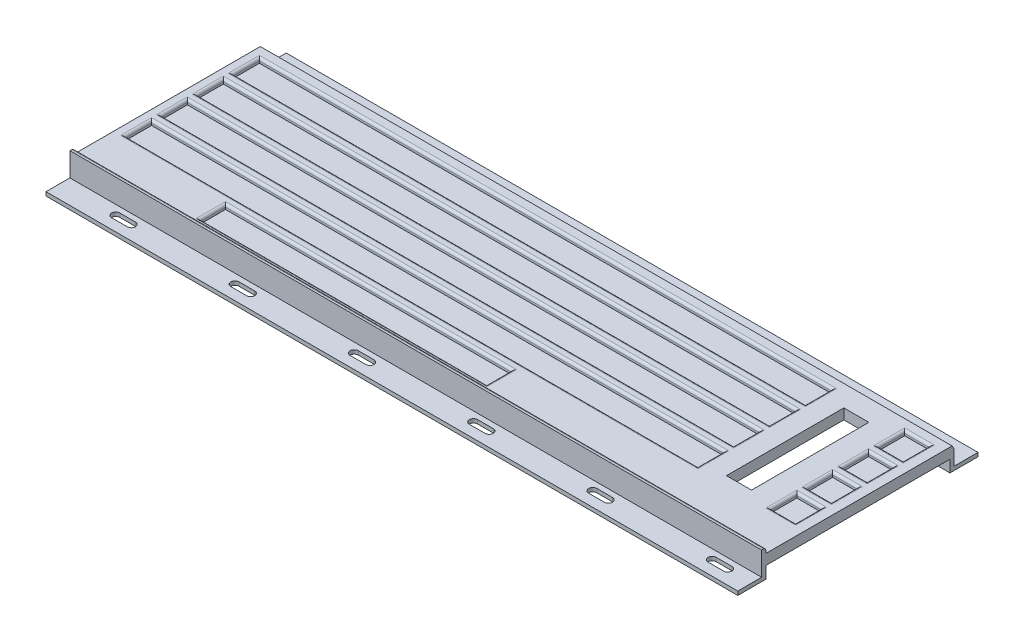
from build123d import *

# Parameters (mm, degrees)
SKETCH1_W                            = 368.3
SKETCH1_H                            = 98.044
BOSS_EXTRUDE1_DEPTH                  = 3.175
SKETCH2_W                            = 368.3
SKETCH2_H                            = 4.445
BOSS_EXTRUDE2_DEPTH                  = 2.38125
SKETCH3_W                            = 368.3
SKETCH3_H                            = 3.81
BOSS_EXTRUDE3_DEPTH                  = 2.38125
SKETCH4_W                            = 368.3
SKETCH4_H                            = 5.08
BOSS_EXTRUDE4_DEPTH                  = 2.38125
SKETCH5_W                            = 368.3
SKETCH5_H                            = 5.08
BOSS_EXTRUDE5_DEPTH                  = 2.38125
SKETCH7_W                            = 368.3
SKETCH7_H                            = 5.08
BOSS_EXTRUDE6_DEPTH                  = 2.38125
SKETCH9_W                            = 368.3
SKETCH9_H                            = 5.08
BOSS_EXTRUDE7_DEPTH                  = 2.38125
SKETCH10_W                           = 6.35
SKETCH10_H                           = 89.789
BOSS_EXTRUDE8_DEPTH                  = 2.38125
SKETCH11_W                           = 5.08
SKETCH11_H                           = 89.789
BOSS_EXTRUDE9_DEPTH                  = 2.38125
SKETCH12_W                           = 13.97
SKETCH12_H                           = 89.789
BOSS_EXTRUDE10_DEPTH                 = 2.38125
SKETCH13_W                           = 12.7
SKETCH13_H                           = 89.789
BOSS_EXTRUDE11_DEPTH                 = 2.38125
SKETCH14_W                           = 13.335
SKETCH14_H                           = 62.484
CUT_EXTRUDE1_DEPTH                   = 191.644304657
SKETCH15_W                           = 12.065
SKETCH15_H                           = 13.335
BOSS_EXTRUDE12_DEPTH                 = 2.38125
SKETCH16_W                           = 12.065
SKETCH16_H                           = 3.175
BOSS_EXTRUDE13_DEPTH                 = 2.38125
SKETCH17_W                           = 12.065
SKETCH17_H                           = 5.715
BOSS_EXTRUDE14_DEPTH                 = 2.38125
SKETCH18_W                           = 13.335
SKETCH18_H                           = 13.335
BOSS_EXTRUDE15_DEPTH                 = 2.38125
SKETCH19_W                           = 58.42
SKETCH19_H                           = 13.335
BOSS_EXTRUDE16_DEPTH                 = 2.38125
SKETCH20_W                           = 93.98
SKETCH20_H                           = 13.335
BOSS_EXTRUDE17_DEPTH                 = 2.38125
SKETCH22_W                           = 368.3
SKETCH22_H                           = 14.605
BOSS_EXTRUDE18_DEPTH                 = 2.2225
SKETCH23_W                           = 368.3
SKETCH23_H                           = 2.032
BOSS_EXTRUDE19_DEPTH                 = 12.7
SKETCH24_W                           = 368.3
SKETCH24_H                           = 11.90625
BOSS_EXTRUDE20_DEPTH                 = 2.2225
SKETCH25_W                           = 368.3
SKETCH25_H                           = 2.032
BOSS_EXTRUDE21_DEPTH                 = 12.7
F_11_64_START                        = -6.35
F_11_64_0_17188_DIAMETER_SLOT1_DEPTH = 2.032
FILLET2_R                            = 1.27
CHAMFER1_SIZE                        = 1.905
CHAMFER1_SIZE2                       = 1.099852263


# Read off the part's stored shape, not the designer's step: 11/64 (0.17188) Diameter Slot1
with BuildPart() as part:
    # Sketch1 → Boss-Extrude1 (new body)
    with BuildSketch(Plane(origin=(0, 0, 0), x_dir=(1, 0, 0), z_dir=(0, 1, 0))):
        Rectangle(SKETCH1_W, SKETCH1_H)
    extrude(amount=BOSS_EXTRUDE1_DEPTH)

    # Sketch2 → Boss-Extrude2 (add)
    with BuildSketch(Plane(origin=(0, 3.175, 0), x_dir=(1, 0, 0), z_dir=(0, 1, 0))):
        with Locations((0, 46.7995)):
            Rectangle(SKETCH2_W, SKETCH2_H)
    extrude(amount=BOSS_EXTRUDE2_DEPTH)

    # Sketch3 → Boss-Extrude3 (add)
    with BuildSketch(Plane(origin=(0, 3.175, 0), x_dir=(1, 0, 0), z_dir=(0, 1, 0))):
        with Locations((0, -47.117)):
            Rectangle(SKETCH3_W, SKETCH3_H)
    extrude(amount=BOSS_EXTRUDE3_DEPTH)

    # Sketch4 → Boss-Extrude4 (add)
    with BuildSketch(Plane(origin=(0, 3.175, 0), x_dir=(1, 0, 0), z_dir=(0, 1, 0))):
        with Locations((0, -29.337)):
            Rectangle(SKETCH4_W, SKETCH4_H)
    extrude(amount=BOSS_EXTRUDE4_DEPTH)

    # Sketch5 → Boss-Extrude5 (add)
    with BuildSketch(Plane(origin=(0, 3.175, 0), x_dir=(1, 0, 0), z_dir=(0, 1, 0))):
        with Locations((0, -10.287)):
            Rectangle(SKETCH5_W, SKETCH5_H)
    extrude(amount=BOSS_EXTRUDE5_DEPTH)

    # Sketch7 → Boss-Extrude6 (add)
    with BuildSketch(Plane(origin=(0, 3.175, 0), x_dir=(1, 0, 0), z_dir=(0, 1, 0))):
        with Locations((0, 8.763)):
            Rectangle(SKETCH7_W, SKETCH7_H)
    extrude(amount=BOSS_EXTRUDE6_DEPTH)

    # Sketch9 → Boss-Extrude7 (add)
    with BuildSketch(Plane(origin=(0, 3.175, 0), x_dir=(1, 0, 0), z_dir=(0, 1, 0))):
        with Locations((0, 27.94)):
            Rectangle(SKETCH9_W, SKETCH9_H)
    extrude(amount=BOSS_EXTRUDE7_DEPTH)

    # Sketch10 → Boss-Extrude8 (add)
    with BuildSketch(Plane(origin=(0, 3.175, 0), x_dir=(1, 0, 0), z_dir=(0, 1, 0))):
        with Locations((180.975, -0.3175)):
            Rectangle(SKETCH10_W, SKETCH10_H)
    extrude(amount=BOSS_EXTRUDE8_DEPTH)

    # Sketch11 → Boss-Extrude9 (add)
    with BuildSketch(Plane(origin=(0, 3.175, 0), x_dir=(1, 0, 0), z_dir=(0, 1, 0))):
        with Locations((-181.61, -0.3175)):
            Rectangle(SKETCH11_W, SKETCH11_H)
    extrude(amount=BOSS_EXTRUDE9_DEPTH)

    # Sketch12 → Boss-Extrude10 (add)
    with BuildSketch(Plane(origin=(0, 3.175, 0), x_dir=(1, 0, 0), z_dir=(0, 1, 0))):
        with Locations((157.48, -0.3175)):
            Rectangle(SKETCH12_W, SKETCH12_H)
    extrude(amount=BOSS_EXTRUDE10_DEPTH)

    # Sketch13 → Boss-Extrude11 (add)
    with BuildSketch(Plane(origin=(0, 3.175, 0), x_dir=(1, 0, 0), z_dir=(0, 1, 0))):
        with Locations((132.08, -0.3175)):
            Rectangle(SKETCH13_W, SKETCH13_H)
    extrude(amount=BOSS_EXTRUDE11_DEPTH)

    # Sketch14 → Cut-Extrude1 (cut, through all)
    with BuildSketch(Plane(origin=(0, 5.55625, 0), x_dir=(1, 0, 0), z_dir=(0, 1, 0))):
        with Locations((144.4625, 7.62)):
            Rectangle(SKETCH14_W, SKETCH14_H)
    extrude(amount=-CUT_EXTRUDE1_DEPTH, mode=Mode.SUBTRACT)

    # Sketch15 → Boss-Extrude12 (add)
    with BuildSketch(Plane(origin=(0, 3.175, 0), x_dir=(1, 0, 0), z_dir=(0, 1, 0))):
        with Locations((144.4625, -38.5445)):
            Rectangle(SKETCH15_W, SKETCH15_H)
    extrude(amount=BOSS_EXTRUDE12_DEPTH)

    # Sketch16 → Boss-Extrude13 (add)
    with BuildSketch(Plane(origin=(0, 3.175, 0), x_dir=(1, 0, 0), z_dir=(0, 1, 0))):
        with Locations((144.4625, -25.2095)):
            Rectangle(SKETCH16_W, SKETCH16_H)
    extrude(amount=BOSS_EXTRUDE13_DEPTH)

    # Sketch17 → Boss-Extrude14 (add)
    with BuildSketch(Plane(origin=(0, 3.175, 0), x_dir=(1, 0, 0), z_dir=(0, 1, 0))):
        with Locations((144.4625, 41.7195)):
            Rectangle(SKETCH17_W, SKETCH17_H)
    extrude(amount=BOSS_EXTRUDE14_DEPTH)

    # Sketch18 → Boss-Extrude15 (add)
    with BuildSketch(Plane(origin=(0, 3.175, 0), x_dir=(1, 0, 0), z_dir=(0, 1, 0))):
        with Locations((171.1325, -38.5445)):
            Rectangle(SKETCH18_W, SKETCH18_H)
    extrude(amount=BOSS_EXTRUDE15_DEPTH)

    # Sketch19 → Boss-Extrude16 (add)
    with BuildSketch(Plane(origin=(0, 3.175, 0), x_dir=(1, 0, 0), z_dir=(0, 1, 0))):
        with Locations((-149.86, -38.5445)):
            Rectangle(SKETCH19_W, SKETCH19_H)
    extrude(amount=BOSS_EXTRUDE16_DEPTH)

    # Sketch20 → Boss-Extrude17 (add)
    with BuildSketch(Plane(origin=(0, 3.175, 0), x_dir=(1, 0, 0), z_dir=(0, 1, 0))):
        with Locations((78.74, -38.5445)):
            Rectangle(SKETCH20_W, SKETCH20_H)
    extrude(amount=BOSS_EXTRUDE17_DEPTH)

    # Sketch22 → Boss-Extrude18 (add)
    with BuildSketch(Plane.XY.offset(49.022)):
        with Locations((0, 0.9525)):
            Rectangle(SKETCH22_W, SKETCH22_H)
    extrude(amount=BOSS_EXTRUDE18_DEPTH)

    # Sketch23 → Boss-Extrude19 (add)
    with BuildSketch(Plane.XY.offset(51.2445)):
        with Locations((0, -5.334)):
            Rectangle(SKETCH23_W, SKETCH23_H)
    extrude(amount=BOSS_EXTRUDE19_DEPTH)

    # Sketch24 → Boss-Extrude20 (add)
    with BuildSketch(Plane(origin=(0, 0, -49.022), x_dir=(-1, 0, 0), z_dir=(0, 0, -1))):
        with Locations((0, -0.396875)):
            Rectangle(SKETCH24_W, SKETCH24_H)
    extrude(amount=BOSS_EXTRUDE20_DEPTH)

    # Sketch25 → Boss-Extrude21 (add)
    with BuildSketch(Plane(origin=(0, 0, -51.2445), x_dir=(-1, 0, 0), z_dir=(0, 0, -1))):
        with Locations((0, -5.334)):
            Rectangle(SKETCH25_W, SKETCH25_H)
    extrude(amount=BOSS_EXTRUDE21_DEPTH)

    # 11/64 (0.17188) Diameter Slot1 outline → 11/64 (0.17188) Diameter Slot1 (cut)
    with BuildSketch(Plane(origin=(0, 0, 0), x_dir=(1, 0, 0), z_dir=(0, 1, 0)).offset(F_11_64_START)):
        with BuildLine():
            Line((-154.662124, -58.507376), (-146.327876, -58.507376))
            ThreePointArc((-146.327876, -58.507376), (-144.145, -56.3245), (-146.327876, -54.141624))
            Line((-146.327876, -54.141624), (-154.662124, -54.141624))
            ThreePointArc((-154.662124, -54.141624), (-156.845, -56.3245), (-154.662124, -58.507376))
        make_face()
        with BuildLine():
            ThreePointArc((-82.827876, -58.507376), (-80.645, -56.3245), (-82.827876, -54.141624))
            Line((-82.827876, -54.141624), (-91.162124, -54.141624))
            ThreePointArc((-91.162124, -54.141624), (-93.345, -56.3245), (-91.162124, -58.507376))
            Line((-91.162124, -58.507376), (-82.827876, -58.507376))
        make_face()
        with BuildLine():
            ThreePointArc((-19.327876, -58.507376), (-17.145, -56.3245), (-19.327876, -54.141624))
            Line((-19.327876, -54.141624), (-27.662124, -54.141624))
            ThreePointArc((-27.662124, -54.141624), (-29.845, -56.3245), (-27.662124, -58.507376))
            Line((-27.662124, -58.507376), (-19.327876, -58.507376))
        make_face()
        with BuildLine():
            ThreePointArc((44.172124, -58.50737603), (46.355, -56.32450003), (44.172124, -54.14162403))
            Line((44.172124, -54.14162403), (35.837876, -54.14162403))
            ThreePointArc((35.837876, -54.14162403), (33.655, -56.32450003), (35.837876, -58.50737603))
            Line((35.837876, -58.50737603), (44.172124, -58.50737603))
        make_face()
        with BuildLine():
            ThreePointArc((107.672124, -58.50737603), (109.855, -56.32450003), (107.672124, -54.14162403))
            Line((107.672124, -54.14162403), (99.337876, -54.14162403))
            ThreePointArc((99.337876, -54.14162403), (97.155, -56.32450003), (99.337876, -58.50737603))
            Line((99.337876, -58.50737603), (107.672124, -58.50737603))
        make_face()
        with BuildLine():
            ThreePointArc((171.172124, -58.507376), (173.355, -56.3245), (171.172124, -54.141624))
            Line((171.172124, -54.141624), (162.837876, -54.141624))
            ThreePointArc((162.837876, -54.141624), (160.655, -56.3245), (162.837876, -58.507376))
            Line((162.837876, -58.507376), (171.172124, -58.507376))
        make_face()
        with BuildLine():
            Line((-154.662124, 55.411624), (-146.327876, 55.411624))
            ThreePointArc((-146.327876, 55.411624), (-144.145, 57.5945), (-146.327876, 59.777376))
            Line((-146.327876, 59.777376), (-154.662124, 59.777376))
            ThreePointArc((-154.662124, 59.777376), (-156.845, 57.5945), (-154.662124, 55.411624))
        make_face()
        with BuildLine():
            ThreePointArc((-82.827876, 55.411624), (-80.645, 57.5945), (-82.827876, 59.777376))
            Line((-82.827876, 59.777376), (-91.162124, 59.777376))
            ThreePointArc((-91.162124, 59.777376), (-93.345, 57.5945), (-91.162124, 55.411624))
            Line((-91.162124, 55.411624), (-82.827876, 55.411624))
        make_face()
        with BuildLine():
            ThreePointArc((-38.377876, 55.411624), (-36.195, 57.5945), (-38.377876, 59.777376))
            Line((-38.377876, 59.777376), (-46.712124, 59.777376))
            ThreePointArc((-46.712124, 59.777376), (-48.895, 57.5945), (-46.712124, 55.411624))
            Line((-46.712124, 55.411624), (-38.377876, 55.411624))
        make_face()
        with BuildLine():
            ThreePointArc((63.222124, 55.411624), (65.405, 57.5945), (63.222124, 59.777376))
            Line((63.222124, 59.777376), (54.887876, 59.777376))
            ThreePointArc((54.887876, 59.777376), (52.705, 57.5945), (54.887876, 55.411624))
            Line((54.887876, 55.411624), (63.222124, 55.411624))
        make_face()
        with BuildLine():
            ThreePointArc((107.672124, 55.411624), (109.855, 57.5945), (107.672124, 59.777376))
            Line((107.672124, 59.777376), (99.337876, 59.777376))
            ThreePointArc((99.337876, 59.777376), (97.155, 57.5945), (99.337876, 55.411624))
            Line((99.337876, 55.411624), (107.672124, 55.411624))
        make_face()
        with BuildLine():
            ThreePointArc((171.172124, 55.411624), (173.355, 57.5945), (171.172124, 59.777376))
            Line((171.172124, 59.777376), (162.837876, 59.777376))
            ThreePointArc((162.837876, 59.777376), (160.655, 57.5945), (162.837876, 55.411624))
            Line((162.837876, 55.411624), (171.172124, 55.411624))
        make_face()
    extrude(amount=F_11_64_0_17188_DIAMETER_SLOT1_DEPTH, mode=Mode.SUBTRACT)

    # Fillet2
    fillet2_edges = [part.edges().sort_by_distance(p)[0] for p in [
        (177.8, 5.55625, 19.812),
        (177.8, 5.55625, 0.762),
        (177.8, 5.55625, -18.3515),
        (177.8, 5.55625, -37.5285),
        (-26.67, 5.55625, -44.577),
        (-26.67, 5.55625, -25.4),
        (-26.67, 5.55625, -6.223),
        (-26.67, 5.55625, 12.827),
        (-179.07, 5.55625, 19.812),
        (-179.07, 5.55625, 0.762),
        (-179.07, 5.55625, -18.3515),
        (-179.07, 5.55625, -37.5285),
        (171.1325, 5.55625, 12.827),
        (171.1325, 5.55625, -6.223),
        (171.1325, 5.55625, -25.4),
        (171.1325, 5.55625, -44.577),
        (164.465, 5.55625, 19.812),
        (164.465, 5.55625, 0.762),
        (164.465, 5.55625, -18.3515),
        (164.465, 5.55625, -37.5285),
        (-26.67, 5.55625, 26.797),
        (-26.67, 5.55625, 7.747),
        (-26.67, 5.55625, -11.303),
        (-26.67, 5.55625, -30.48),
        (125.73, 5.55625, 19.812),
        (125.73, 5.55625, 0.762),
        (125.73, 5.55625, -18.3515),
        (125.73, 5.55625, -37.5285),
        (-44.45, 5.55625, 31.877),
        (-120.65, 5.55625, 38.5445),
        (-44.45, 5.55625, 45.212),
        (31.75, 5.55625, 38.5445),
        (0, 8.255, 49.022),
        (171.1325, 5.55625, -30.48),
        (171.1325, 5.55625, -11.303),
        (171.1325, 5.55625, 7.747),
        (171.1325, 5.55625, 26.797),
    ]]
    fillet(fillet2_edges, radius=FILLET2_R)

    # Chamfer1
    chamfer1_edges = [part.edges().sort_by_distance(p)[0] for p in [
        (0, 5.55625, -51.2445),
    ]]
    chamfer1_side = [part.faces().sort_by_distance(p)[0] for p in [
        (0, 0.619125, -51.2445),
    ]]
    chamfer(chamfer1_edges, length=CHAMFER1_SIZE, length2=CHAMFER1_SIZE2, reference=chamfer1_side[0])


solid = part.part
